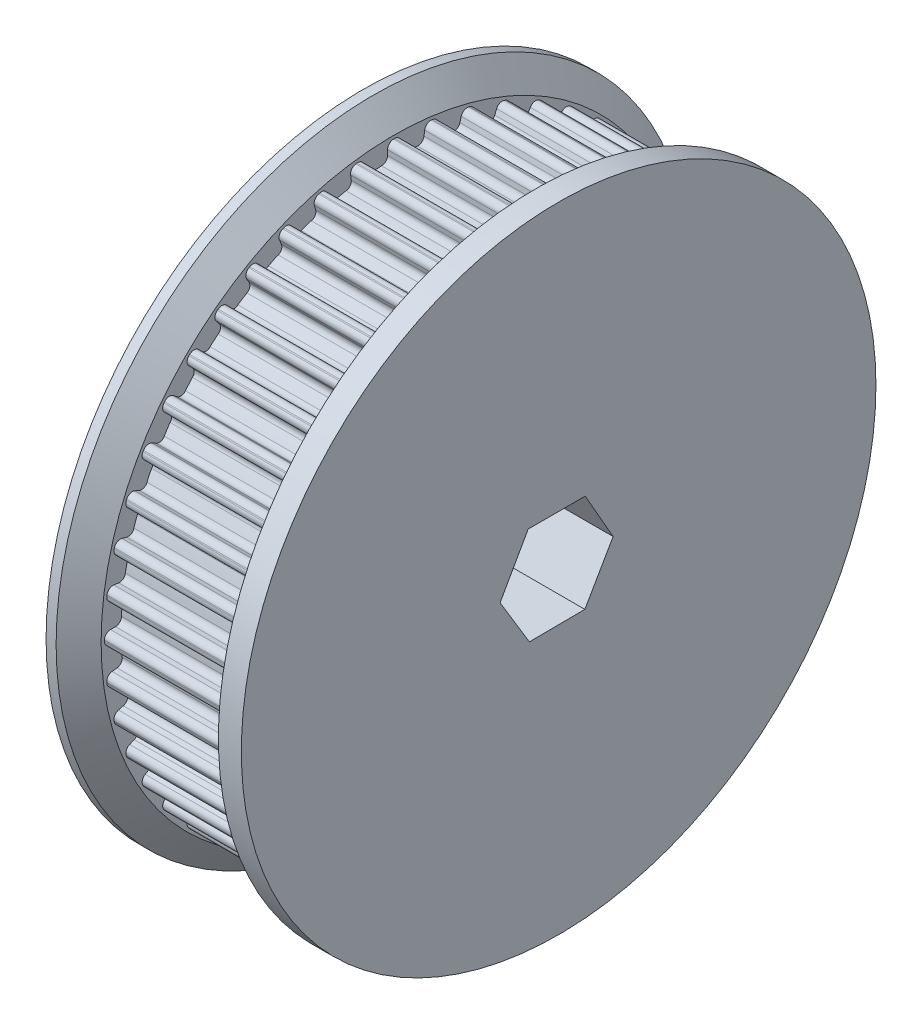
from build123d import *

# Parameters (mm, degrees)
SKETCH1_R                = 35.695
BOSS_EXTRUDE1_DEPTH      = 18.54
BOSS_EXTRUDE6_DEPTH      = 18.5
FILLET6_R                = 0.8
CIRPATTERN6_COUNT        = 48
FILLET6_OF_CIRPATTERN6_R = 0.8
SKETCH10_R               = 41.5
BOSS_EXTRUDE7_DEPTH      = 3
BOSS_EXTRUDE8_START      = 4
SKETCH11_R               = 41.5
BOSS_EXTRUDE8_DEPTH      = 4
CHAMFER1_SIZE            = 3.2
CHAMFER1_SIZE2           = 2.68511882
CUT_EXTRUDE5_DEPTH       = 63.517770274
CUT_EXTRUDE5_DEPTH_BACK  = 63.517770274


with BuildPart() as part:
    # Sketch1 → Boss-Extrude1 (new body)
    with BuildSketch(Plane(origin=(0, 0, 0), x_dir=(0, 0, -1), z_dir=(1, 0, 0))):
        Circle(SKETCH1_R)
    extrude(amount=BOSS_EXTRUDE1_DEPTH)

    # Sketch8 → Boss-Extrude6 (add)
    with BuildSketch(Plane(origin=(18.54, 0, 0), x_dir=(0, 0, -1), z_dir=(1, 0, 0))):
        Polygon((0, 37.907575829), (0.875, 37.907575829), (0.875, 35.547575829), (-0.875, 35.547575829), (-0.875, 37.907575829), align=None)
    boss_extrude6 = extrude(amount=-BOSS_EXTRUDE6_DEPTH)

    # Fillet6
    fillet6_edges = [part.edges().sort_by_distance(p)[0] for p in [
        (9.29, 35.684273847, -0.875),
        (9.29, 35.684273847, 0.875),
        (9.29, 37.907575829, -0.875),
        (9.29, 37.907575829, 0.875),
    ]]
    fillet(fillet6_edges, radius=FILLET6_R)

    # CirPattern6: Boss-Extrude6 ×48 about axis
    cirpattern6_axis = Axis((18.54, 0, 0), (-1, 0, 0))
    for i in range(1, CIRPATTERN6_COUNT):
        add(boss_extrude6.rotate(cirpattern6_axis, i * 360 / CIRPATTERN6_COUNT))

    # Fillet6 of CirPattern6
    fillet6_of_cirpattern6_edges = [part.edges().sort_by_distance(p)[0] for p in [
        (9.29, 35.264779519, -5.525246641),
        (9.29, 35.493200356, -3.790218134),
        (9.29, 37.469060845, -5.815445783),
        (9.29, 37.697481681, -4.080417276),
        (9.29, 34.241895037, -10.08095478),
        (9.29, 34.694828366, -8.390584584),
        (9.29, 36.389439841, -10.656387676),
        (9.29, 36.84237317, -8.96601748),
        (9.29, 32.633122237, -14.464174988),
        (9.29, 33.302818243, -12.847385806),
        (9.29, 34.687185432, -15.314995822),
        (9.29, 35.356881439, -13.69820664),
        (9.29, 30.465987667, -18.599909152),
        (9.29, 31.340987667, -17.084364695),
        (9.29, 32.391423664, -19.711560143),
        (9.29, 33.266423664, -18.196015686),
        (9.29, 27.777571602, -22.417393713),
        (9.29, 28.842904103, -21.029025368),
        (9.29, 29.541435656, -23.770854205),
        (9.29, 30.606768157, -22.382485859),
        (9.29, 24.613873586, -25.851310453),
        (9.29, 25.851310453, -24.613873586),
        (9.29, 26.185985494, -27.423422361),
        (9.29, 27.423422361, -26.185985494),
        (9.29, 21.029025368, -28.842904103),
        (9.29, 22.417393713, -27.777571602),
        (9.29, 22.382485859, -30.606768157),
        (9.29, 23.770854205, -29.541435656),
        (9.29, 17.084364695, -31.340987667),
        (9.29, 18.599909152, -30.465987667),
        (9.29, 18.196015686, -33.266423664),
        (9.29, 19.711560143, -32.391423664),
        (9.29, 12.847385806, -33.302818243),
        (9.29, 14.464174988, -32.633122237),
        (9.29, 13.69820664, -35.356881439),
        (9.29, 15.314995822, -34.687185432),
        (9.29, 8.390584584, -34.694828366),
        (9.29, 10.08095478, -34.241895037),
        (9.29, 8.96601748, -36.84237317),
        (9.29, 10.656387676, -36.389439841),
        (9.29, 3.790218134, -35.493200356),
        (9.29, 5.525246641, -35.264779519),
        (9.29, 4.080417276, -37.697481681),
        (9.29, 5.815445783, -37.469060845),
        (9.29, -0.875, -35.684273847),
        (9.29, 0.875, -35.684273847),
        (9.29, -0.875, -37.907575829),
        (9.29, 0.875, -37.907575829),
        (9.29, -5.525246641, -35.264779519),
        (9.29, -3.790218134, -35.493200356),
        (9.29, -5.815445783, -37.469060845),
        (9.29, -4.080417276, -37.697481681),
        (9.29, -10.08095478, -34.241895037),
        (9.29, -8.390584584, -34.694828366),
        (9.29, -10.656387676, -36.389439841),
        (9.29, -8.96601748, -36.84237317),
        (9.29, -14.464174988, -32.633122237),
        (9.29, -12.847385806, -33.302818243),
        (9.29, -15.314995822, -34.687185432),
        (9.29, -13.69820664, -35.356881439),
        (9.29, -18.599909152, -30.465987667),
        (9.29, -17.084364695, -31.340987667),
        (9.29, -19.711560143, -32.391423664),
        (9.29, -18.196015686, -33.266423664),
        (9.29, -22.417393713, -27.777571602),
        (9.29, -21.029025368, -28.842904103),
        (9.29, -23.770854205, -29.541435656),
        (9.29, -22.382485859, -30.606768157),
        (9.29, -25.851310453, -24.613873586),
        (9.29, -24.613873586, -25.851310453),
        (9.29, -27.423422361, -26.185985494),
        (9.29, -26.185985494, -27.423422361),
        (9.29, -28.842904103, -21.029025368),
        (9.29, -27.777571602, -22.417393713),
        (9.29, -30.606768157, -22.382485859),
        (9.29, -29.541435656, -23.770854205),
        (9.29, -31.340987667, -17.084364695),
        (9.29, -30.465987667, -18.599909152),
        (9.29, -33.266423664, -18.196015686),
        (9.29, -32.391423664, -19.711560143),
        (9.29, -33.302818243, -12.847385806),
        (9.29, -32.633122237, -14.464174988),
        (9.29, -35.356881439, -13.69820664),
        (9.29, -34.687185432, -15.314995822),
        (9.29, -34.694828366, -8.390584584),
        (9.29, -34.241895037, -10.08095478),
        (9.29, -36.84237317, -8.96601748),
        (9.29, -36.389439841, -10.656387676),
        (9.29, -35.493200356, -3.790218134),
        (9.29, -35.264779519, -5.525246641),
        (9.29, -37.697481681, -4.080417276),
        (9.29, -37.469060845, -5.815445783),
        (9.29, -35.684273847, 0.875),
        (9.29, -35.684273847, -0.875),
        (9.29, -37.907575829, 0.875),
        (9.29, -37.907575829, -0.875),
        (9.29, -35.264779519, 5.525246641),
        (9.29, -35.493200356, 3.790218134),
        (9.29, -37.469060845, 5.815445783),
        (9.29, -37.697481681, 4.080417276),
        (9.29, -34.241895037, 10.08095478),
        (9.29, -34.694828366, 8.390584584),
        (9.29, -36.389439841, 10.656387676),
        (9.29, -36.84237317, 8.96601748),
        (9.29, -32.633122237, 14.464174988),
        (9.29, -33.302818243, 12.847385806),
        (9.29, -34.687185432, 15.314995822),
        (9.29, -35.356881439, 13.69820664),
        (9.29, -30.465987667, 18.599909152),
        (9.29, -31.340987667, 17.084364695),
        (9.29, -32.391423664, 19.711560143),
        (9.29, -33.266423664, 18.196015686),
        (9.29, -27.777571602, 22.417393713),
        (9.29, -28.842904103, 21.029025368),
        (9.29, -29.541435656, 23.770854205),
        (9.29, -30.606768157, 22.382485859),
        (9.29, -24.613873586, 25.851310453),
        (9.29, -25.851310453, 24.613873586),
        (9.29, -26.185985494, 27.423422361),
        (9.29, -27.423422361, 26.185985494),
        (9.29, -21.029025368, 28.842904103),
        (9.29, -22.417393713, 27.777571602),
        (9.29, -22.382485859, 30.606768157),
        (9.29, -23.770854205, 29.541435656),
        (9.29, -17.084364695, 31.340987667),
        (9.29, -18.599909152, 30.465987667),
        (9.29, -18.196015686, 33.266423664),
        (9.29, -19.711560143, 32.391423664),
        (9.29, -12.847385806, 33.302818243),
        (9.29, -14.464174988, 32.633122237),
        (9.29, -13.69820664, 35.356881439),
        (9.29, -15.314995822, 34.687185432),
        (9.29, -8.390584584, 34.694828366),
        (9.29, -10.08095478, 34.241895037),
        (9.29, -8.96601748, 36.84237317),
        (9.29, -10.656387676, 36.389439841),
        (9.29, -3.790218134, 35.493200356),
        (9.29, -5.525246641, 35.264779519),
        (9.29, -4.080417276, 37.697481681),
        (9.29, -5.815445783, 37.469060845),
        (9.29, 0.875, 35.684273847),
        (9.29, -0.875, 35.684273847),
        (9.29, 0.875, 37.907575829),
        (9.29, -0.875, 37.907575829),
        (9.29, 5.525246641, 35.264779519),
        (9.29, 3.790218134, 35.493200356),
        (9.29, 5.815445783, 37.469060845),
        (9.29, 4.080417276, 37.697481681),
        (9.29, 10.08095478, 34.241895037),
        (9.29, 8.390584584, 34.694828366),
        (9.29, 10.656387676, 36.389439841),
        (9.29, 8.96601748, 36.84237317),
        (9.29, 14.464174988, 32.633122237),
        (9.29, 12.847385806, 33.302818243),
        (9.29, 15.314995822, 34.687185432),
        (9.29, 13.69820664, 35.356881439),
        (9.29, 18.599909152, 30.465987667),
        (9.29, 17.084364695, 31.340987667),
        (9.29, 19.711560143, 32.391423664),
        (9.29, 18.196015686, 33.266423664),
        (9.29, 22.417393713, 27.777571602),
        (9.29, 21.029025368, 28.842904103),
        (9.29, 23.770854205, 29.541435656),
        (9.29, 22.382485859, 30.606768157),
        (9.29, 25.851310453, 24.613873586),
        (9.29, 24.613873586, 25.851310453),
        (9.29, 27.423422361, 26.185985494),
        (9.29, 26.185985494, 27.423422361),
        (9.29, 28.842904103, 21.029025368),
        (9.29, 27.777571602, 22.417393713),
        (9.29, 30.606768157, 22.382485859),
        (9.29, 29.541435656, 23.770854205),
        (9.29, 31.340987667, 17.084364695),
        (9.29, 30.465987667, 18.599909152),
        (9.29, 33.266423664, 18.196015686),
        (9.29, 32.391423664, 19.711560143),
        (9.29, 33.302818243, 12.847385806),
        (9.29, 32.633122237, 14.464174988),
        (9.29, 35.356881439, 13.69820664),
        (9.29, 34.687185432, 15.314995822),
        (9.29, 34.694828366, 8.390584584),
        (9.29, 34.241895037, 10.08095478),
        (9.29, 36.84237317, 8.96601748),
        (9.29, 36.389439841, 10.656387676),
        (9.29, 35.493200356, 3.790218134),
        (9.29, 35.264779519, 5.525246641),
        (9.29, 37.697481681, 4.080417276),
        (9.29, 37.469060845, 5.815445783),
    ]]
    fillet(fillet6_of_cirpattern6_edges, radius=FILLET6_OF_CIRPATTERN6_R)

    # Sketch10 → Boss-Extrude7 (add)
    with BuildSketch(Plane(origin=(18.54, 0, 0), x_dir=(0, 0, -1), z_dir=(1, 0, 0))):
        Circle(SKETCH10_R)
    extrude(amount=BOSS_EXTRUDE7_DEPTH)

    # Sketch11 → Boss-Extrude8 (add)
    with BuildSketch(Plane.ZY.offset(BOSS_EXTRUDE8_START)):
        Circle(SKETCH11_R)
    extrude(amount=-BOSS_EXTRUDE8_DEPTH)

    # Chamfer1
    chamfer1_edges = [part.edges().sort_by_distance(p)[0] for p in [
        (0, 0, -41.5),
    ]]
    chamfer1_side = [part.faces().sort_by_distance(p)[0] for p in [
        (0, 0, -40.326202743),
    ]]
    chamfer(chamfer1_edges, length=CHAMFER1_SIZE, length2=CHAMFER1_SIZE2, reference=chamfer1_side[0])

    # Sketch9 → Cut-Extrude5 (cut, two sides: drawn at the far end of the back side and taken through both)
    with BuildSketch(Plane.ZY.offset(-CUT_EXTRUDE5_DEPTH_BACK)):
        Polygon((-3.471061286, 6.444457654), (-7.125456531, 0.043657654), (-3.429837967, -6.357142346), (3.826782025, -6.409720657), (7.655941161, -0.063516257), (3.981752634, 6.444457654), align=None)
    extrude(amount=CUT_EXTRUDE5_DEPTH + CUT_EXTRUDE5_DEPTH_BACK, mode=Mode.SUBTRACT)


solid = part.part
